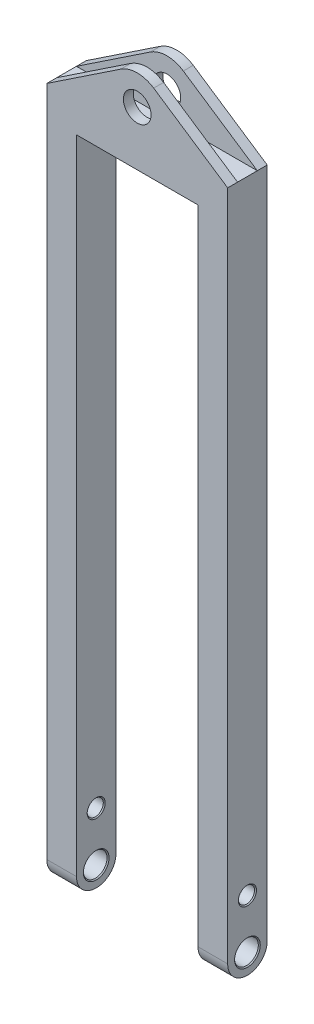
from build123d import *

# Parameters (mm, degrees)
DODANIE_WYCI_GNI_CIE1_DEPTH = 40
ZAOKR_GLENIE1_R             = 20
SZKIC2_R                    = 12
WYTNIJ_WYCI_GNI_CIE1_DEPTH  = 725.630250542
SZKIC3_R                    = 8.15
WYTNIJ_WYCI_GNI_CIE2_DEPTH  = 725.630250542
SZKIC5_R                    = 14
DODANIE_WYCI_GNI_CIE2_DEPTH = 40
SZKIC6_W                    = 20
SZKIC6_H                    = 55
WYTNIJ_WYCI_GNI_CIE4_DEPTH  = 778.890737829
SZKIC4_R                    = 1.65
WYTNIJ_WYCI_GNI_CIE5_DEPTH  = 10
SFAZOWANIE1_SIZE            = 0.5
SFAZOWANIE2_SIZE            = 1


with BuildPart() as part:
    # Szkic1 → Dodanie-wyciągnięcie1 (new body)
    with BuildSketch(Plane.XY):
        Polygon((0, 0), (30, 0), (30, 670), (153, 670), (153, 0), (183, 0), (183, 700), (110, 700), (30, 700), (0, 700), align=None)
    extrude(amount=DODANIE_WYCI_GNI_CIE1_DEPTH)

    # Zaokrąglenie1
    zaokr_glenie1_edges = [part.edges().sort_by_distance(p)[0] for p in [
        (168, 0, 0),
        (168, 0, 40),
        (15, 0, 0),
        (15, 0, 40),
    ]]
    fillet(zaokr_glenie1_edges, radius=ZAOKR_GLENIE1_R - 0.0001)  # a hair under: the kernel refuses the full size

    # Szkic2 → Wytnij-wyciągnięcie1 (cut, through all)
    with BuildSketch(Plane.ZY):
        with Locations((20, 20)):
            Circle(SZKIC2_R)
    extrude(amount=-WYTNIJ_WYCI_GNI_CIE1_DEPTH, mode=Mode.SUBTRACT)

    # Szkic3 → Wytnij-wyciągnięcie2 (cut, through all)
    with BuildSketch(Plane(origin=(183, 0, 0), x_dir=(0, 0, -1), z_dir=(1, 0, 0))):
        with Locations(Location((-20, 70, 0), (0, 0, 90))):
            Circle(SZKIC3_R)
    extrude(amount=-WYTNIJ_WYCI_GNI_CIE2_DEPTH, mode=Mode.SUBTRACT)

    # Szkic5 → Dodanie-wyciągnięcie2 (add)
    with BuildSketch(Plane(origin=(0, 0, 0), x_dir=(-1, 0, 0), z_dir=(0, 0, -1))):
        with BuildLine():
            Line((-183, 700), (0, 700))
            Line((0, 700), (-74.84618459, 749.952964399))
            ThreePointArc((-74.84618459, 749.952964399), (-91.5, 755), (-108.15381541, 749.952964399))
            Line((-108.15381541, 749.952964399), (-183, 700))
        make_face()
        with Locations((-91.5, 725)):
            Circle(SZKIC5_R, mode=Mode.SUBTRACT)
    extrude(amount=-DODANIE_WYCI_GNI_CIE2_DEPTH)

    # Szkic6 → Wytnij-wyciągnięcie4 (cut, through all)
    with BuildSketch(Plane(origin=(183, 0, 0), x_dir=(0, 0, -1), z_dir=(1, 0, 0))):
        with Locations((-20, 727.5)):
            Rectangle(SZKIC6_W, SZKIC6_H)
    extrude(amount=-WYTNIJ_WYCI_GNI_CIE4_DEPTH, mode=Mode.SUBTRACT)

    # Szkic4 → Wytnij-wyciągnięcie5 (cut)
    with BuildSketch(Plane.ZY.offset(-153)):
        with Locations(Location((20, 657.5, 0), (0, 0, 270))):
            Circle(SZKIC4_R)
        with Locations(Location((20, 597.5, 0), (0, 0, 270))):
            Circle(SZKIC4_R)
        with Locations(Location((20, 537.5, 0), (0, 0, 270))):
            Circle(SZKIC4_R)
        with Locations(Location((20, 477.5, 0), (0, 0, 270))):
            Circle(SZKIC4_R)
        with Locations(Location((20, 417.5, 0), (0, 0, 270))):
            Circle(SZKIC4_R)
    extrude(amount=-WYTNIJ_WYCI_GNI_CIE5_DEPTH, mode=Mode.SUBTRACT)

    # Sfazowanie1
    sfazowanie1_edges = [part.edges().sort_by_distance(p)[0] for p in [
        (153, 659.15, 20),
        (153, 599.15, 20),
        (153, 539.15, 20),
        (153, 479.15, 20),
        (153, 419.15, 20),
    ]]
    chamfer(sfazowanie1_edges, length=SFAZOWANIE1_SIZE)

    # Sfazowanie2
    sfazowanie2_edges = [part.edges().sort_by_distance(p)[0] for p in [
        (30, 20, 8),
        (183, 20, 8),
        (153, 20, 8),
        (0, 20, 8),
        (0, 61.85, 20),
        (30, 61.85, 20),
        (153, 61.85, 20),
        (183, 61.85, 20),
    ]]
    chamfer(sfazowanie2_edges, length=SFAZOWANIE2_SIZE)


solid = part.part
